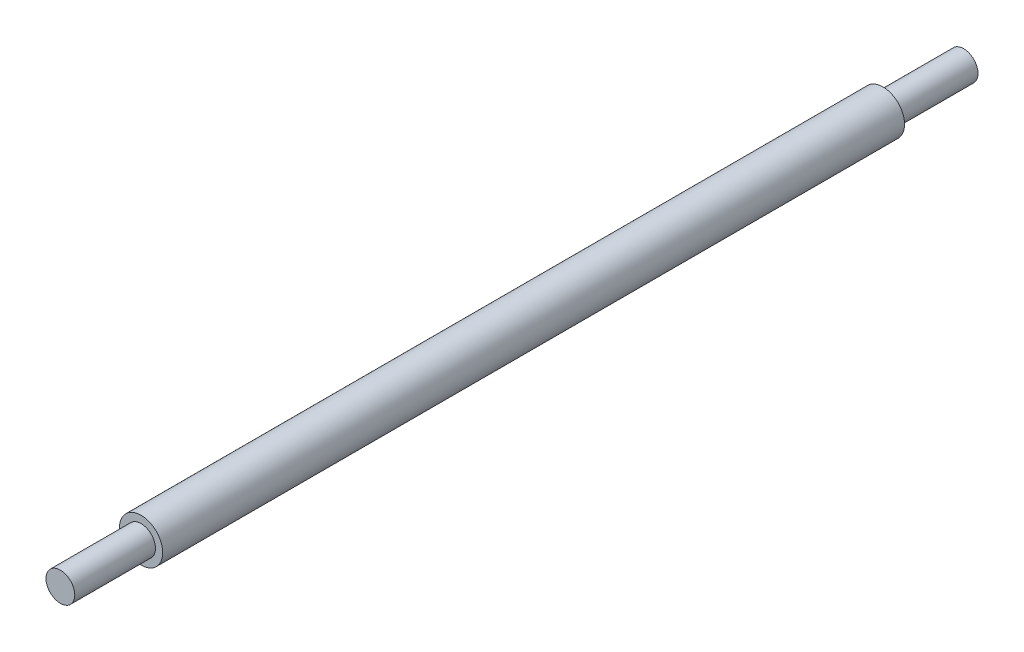
from build123d import *

# Parameters (mm, degrees)
SKETCH1_R           = 9.525
BOSS_EXTRUDE1_DEPTH = 327.025
SKETCH2_R           = 6.35
BOSS_EXTRUDE2_DEPTH = 35.56
BOSS_EXTRUDE3_START = 35.56
SKETCH3_R           = 6.35
BOSS_EXTRUDE3_DEPTH = 35.56


with BuildPart() as part:
    # Sketch1 → Boss-Extrude1 (new body)
    with BuildSketch(Plane.XY):
        Circle(SKETCH1_R)
    extrude(amount=BOSS_EXTRUDE1_DEPTH)

    # Sketch2 → Boss-Extrude2 (add)
    with BuildSketch(Plane.XY.offset(327.025)):
        Circle(SKETCH2_R)
    extrude(amount=BOSS_EXTRUDE2_DEPTH)

    # Sketch3 → Boss-Extrude3 (add)
    with BuildSketch(Plane(origin=(0, 0, 0), x_dir=(-1, 0, 0), z_dir=(0, 0, -1)).offset(BOSS_EXTRUDE3_START)):
        Circle(SKETCH3_R)
    extrude(amount=-BOSS_EXTRUDE3_DEPTH)


solid = part.part
